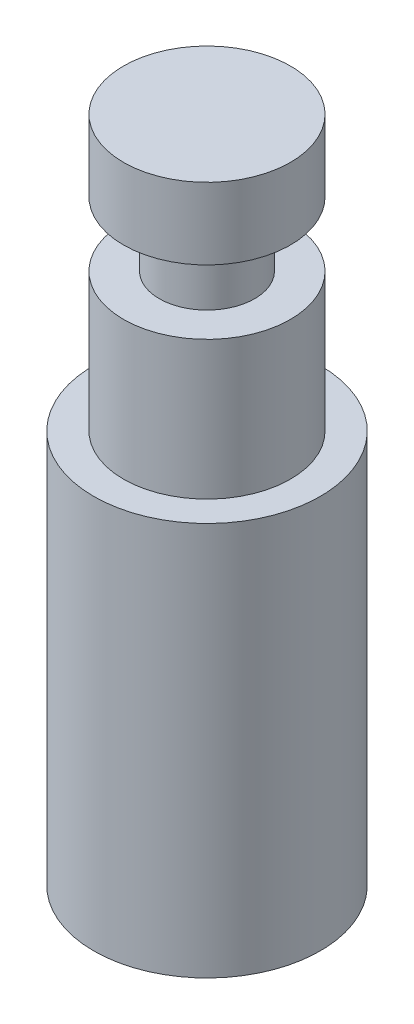
from build123d import *

# Parameters (mm, degrees)
SKETCH1_R           = 4.75
BOSS_EXTRUDE1_DEPTH = 28
SKETCH2_OUTSIDE_W   = 17.712
SKETCH2_OUTSIDE_H   = 17.712
SKETCH2_OUTSIDE_R   = 3.5
CUT_EXTRUDE1_DEPTH  = 11.5
CUT_EXTRUDE2_START  = -3
SKETCH3_OUTSIDE_W   = 17.712
SKETCH3_OUTSIDE_H   = 17.712
SKETCH3_OUTSIDE_R   = 2
CUT_EXTRUDE2_DEPTH  = 2.7


with BuildPart() as part:
    # Sketch1 → Boss-Extrude1 (new body)
    with BuildSketch(Plane(origin=(0, 0, 0), x_dir=(1, 0, 0), z_dir=(0, 1, 0))):
        Circle(SKETCH1_R)
    extrude(amount=BOSS_EXTRUDE1_DEPTH)

    # Sketch2 outside → Cut-Extrude1 (cut)
    with BuildSketch(Plane(origin=(0, 28, 0), x_dir=(1, 0, 0), z_dir=(0, 1, 0))):
        Rectangle(SKETCH2_OUTSIDE_W, SKETCH2_OUTSIDE_H)
        Circle(SKETCH2_OUTSIDE_R, mode=Mode.SUBTRACT)
    extrude(amount=-CUT_EXTRUDE1_DEPTH, mode=Mode.SUBTRACT)

    # Sketch3 outside → Cut-Extrude2 (cut)
    with BuildSketch(Plane(origin=(0, 28, 0), x_dir=(1, 0, 0), z_dir=(0, 1, 0)).offset(CUT_EXTRUDE2_START)):
        Rectangle(SKETCH3_OUTSIDE_W, SKETCH3_OUTSIDE_H)
        Circle(SKETCH3_OUTSIDE_R, mode=Mode.SUBTRACT)
    extrude(amount=-CUT_EXTRUDE2_DEPTH, mode=Mode.SUBTRACT)


solid = part.part
